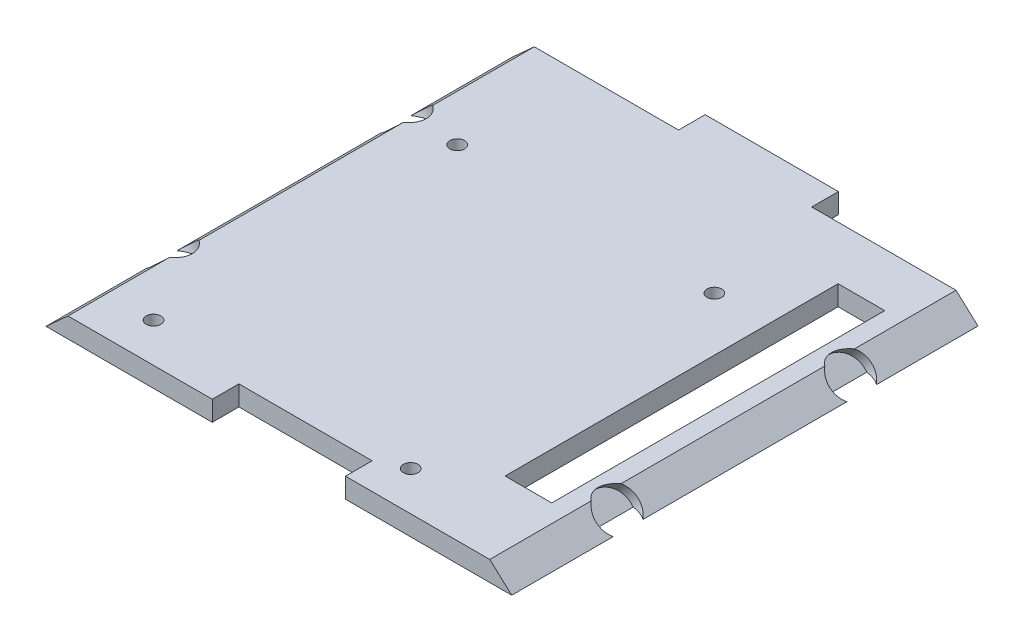
from build123d import *

# Parameters (mm, degrees)
BOSS_EXTRUDE1_DEPTH = 88.9
SKETCH2_R           = 1.397
CUT_EXTRUDE1_DEPTH  = 100.443456884
SKETCH3_W           = 25.4
SKETCH3_H           = 5.08
CUT_EXTRUDE2_DEPTH  = 100.443456884
SKETCH5_W           = 25.4
SKETCH5_H           = 10.16
BOSS_EXTRUDE3_DEPTH = 3.81
SKETCH6_W           = 8.89
SKETCH6_H           = 63.5
CUT_EXTRUDE3_DEPTH  = 100.443456884
SKETCH7_R           = 4
CUT_EXTRUDE4_DEPTH  = 2
SKETCH8_R           = 4
CUT_EXTRUDE5_DEPTH  = 2


with BuildPart() as part:
    # Sketch1 → Boss-Extrude1 (new body)
    with BuildSketch(Plane.XY):
        Polygon((-40.203883769, 5.937788296), (40.203883769, 5.937788296), (44.399042974, 2.127788296), (-44.399042974, 2.127788296), align=None)
    extrude(amount=BOSS_EXTRUDE1_DEPTH)

    # Sketch2 → Cut-Extrude1 (cut, through all)
    with BuildSketch(Plane.XZ.offset(-2.127788296)):
        with Locations((-31.369, 81.429995649)):
            Circle(SKETCH2_R)
        with Locations((17.653, 23.517995649)):
            Circle(SKETCH2_R)
        with Locations((-31.369, 23.517995649)):
            Circle(SKETCH2_R)
        with Locations((17.653, 81.429995649)):
            Circle(SKETCH2_R)
    extrude(amount=-CUT_EXTRUDE1_DEPTH, mode=Mode.SUBTRACT)

    # Sketch3 → Cut-Extrude2 (cut, through all)
    with BuildSketch(Plane.XZ.offset(-2.127788296)):
        with Locations((0, 86.36)):
            Rectangle(SKETCH3_W, SKETCH3_H)
        with Locations((0, 2.54)):
            Rectangle(SKETCH3_W, SKETCH3_H)
    extrude(amount=-CUT_EXTRUDE2_DEPTH, mode=Mode.SUBTRACT)

    # Sketch5 → Boss-Extrude3 (add)
    with BuildSketch(Plane.XZ.offset(-2.127788296)):
        Rectangle(SKETCH5_W, SKETCH5_H)
    extrude(amount=-BOSS_EXTRUDE3_DEPTH)

    # Sketch6 → Cut-Extrude3 (cut, through all)
    with BuildSketch(Plane.XZ.offset(-2.127788296)):
        with Locations((32.334042974, 41.91)):
            Rectangle(SKETCH6_W, SKETCH6_H)
    extrude(amount=-CUT_EXTRUDE3_DEPTH, mode=Mode.SUBTRACT)

    # Sketch7 → Cut-Extrude4 (cut)
    with BuildSketch(Plane(origin=(21.127225221, 23.263011377, 0), x_dir=(0.7402720771062566, -0.6723074087475077, 0), z_dir=(0.6723074087475077, 0.7402720771062566, 0))):
        with Locations((28.603318705, -66.717704672)):
            Circle(SKETCH7_R)
        with Locations((28.603318705, -22.182295328)):
            Circle(SKETCH7_R)
    extrude(amount=-CUT_EXTRUDE4_DEPTH, mode=Mode.SUBTRACT)

    # Sketch8 → Cut-Extrude5 (cut)
    with BuildSketch(Plane(origin=(-21.127225221, 23.263011377, 0), x_dir=(0.7402720771062566, 0.6723074087475077, 0), z_dir=(-0.6723074087475077, 0.7402720771062566, 0))):
        with Locations((-28.603318705, -22.157210382)):
            Circle(SKETCH8_R)
        with Locations((-28.603318705, -66.742789618)):
            Circle(SKETCH8_R)
    extrude(amount=-CUT_EXTRUDE5_DEPTH, mode=Mode.SUBTRACT)


solid = part.part
